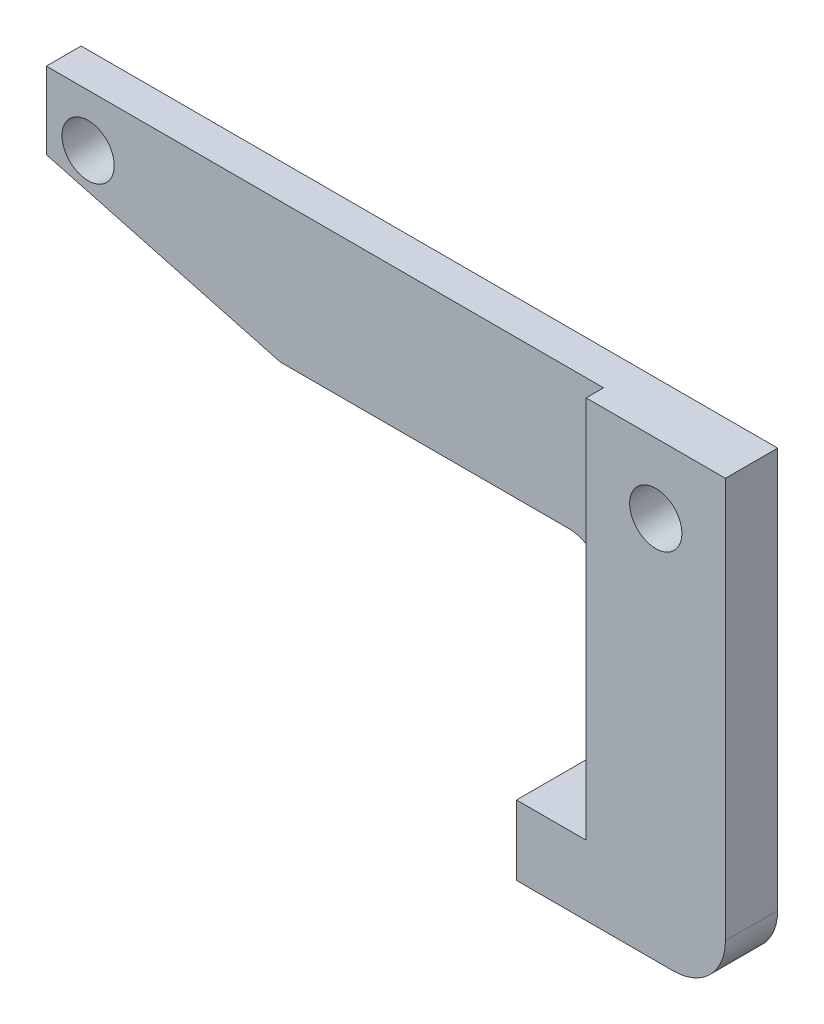
from build123d import *

# Parameters (mm, degrees)
BASE_EXTRUDE_DEPTH = 12.7
SKETCH2_R          = 4.7625
CUT_EXTRUDE1_DEPTH = 135.554087638
SKETCH3_R          = 4.7625
CUT_EXTRUDE2_DEPTH = 135.554087638
CHAMFER1_SIZE      = 11.43
CHAMFER1_SIZE2     = 42.657340731
SKETCH4_W          = 101.6
SKETCH4_H          = 25.4
CUT_EXTRUDE3_DEPTH = 3.175
FILLET1_R          = 9.525
FILLET2_R          = 6.35
CHAMFER2_SIZE      = 3.175
SKETCH5_R          = 9.525
CUT_EXTRUDE4_DEPTH = 4.445


with BuildPart() as part:
    # Sketch1 → Base-Extrude (new body)
    with BuildSketch(Plane.XY):
        Polygon((-114.3, 12.7), (12.7, 12.7), (12.7, -69.85), (-25.4, -69.85), (-25.4, -57.15), (-12.7, -57.15), (-12.7, -12.7), (-114.3, -12.7), align=None)
    extrude(amount=BASE_EXTRUDE_DEPTH)

    # Sketch2 → Cut-Extrude1 (cut, through all)
    with BuildSketch(Plane.XY.offset(12.7)):
        Circle(SKETCH2_R)
    extrude(amount=-CUT_EXTRUDE1_DEPTH, mode=Mode.SUBTRACT)

    # Sketch3 → Cut-Extrude2 (cut, through all)
    with BuildSketch(Plane.XY.offset(12.7)):
        with Locations((-106.68, 3.175)):
            Circle(SKETCH3_R)
    extrude(amount=-CUT_EXTRUDE2_DEPTH, mode=Mode.SUBTRACT)

    # Chamfer1
    chamfer1_edges = [part.edges().sort_by_distance(p)[0] for p in [
        (-114.3, -12.7, 6.35),
    ]]
    chamfer1_side = [part.faces().sort_by_distance(p)[0] for p in [
        (-114.3, 0, 6.35),
    ]]
    chamfer(chamfer1_edges, length=CHAMFER1_SIZE, length2=CHAMFER1_SIZE2, reference=chamfer1_side[0])

    # Sketch4 → Cut-Extrude3 (cut)
    with BuildSketch(Plane.XY.offset(12.7)):
        with Locations((-63.5, 0)):
            Rectangle(SKETCH4_W, SKETCH4_H)
    extrude(amount=-CUT_EXTRUDE3_DEPTH, mode=Mode.SUBTRACT)

    # Fillet1
    fillet1_edges = [part.edges().sort_by_distance(p)[0] for p in [
        (12.7, -69.85, 6.35),
    ]]
    fillet(fillet1_edges, radius=FILLET1_R)

    # Fillet2
    fillet2_edges = [part.edges().sort_by_distance(p)[0] for p in [
        (-12.7, -12.7, 4.7625),
    ]]
    fillet(fillet2_edges, radius=FILLET2_R)

    # Chamfer2
    chamfer2_edges = [part.edges().sort_by_distance(p)[0] for p in [
        (-11.1125, -69.85, 0),
        (9.910192091, -67.060192091, 0),
        (12.7, -23.8125, 0),
        (-50.8, 12.7, 0),
    ]]
    chamfer(chamfer2_edges, length=CHAMFER2_SIZE)

    # Sketch5 → Cut-Extrude4 (cut)
    with BuildSketch(Plane(origin=(0, 0, 0), x_dir=(-1, 0, 0), z_dir=(0, 0, -1))):
        Circle(SKETCH5_R)
    extrude(amount=-CUT_EXTRUDE4_DEPTH, mode=Mode.SUBTRACT)


solid = part.part
